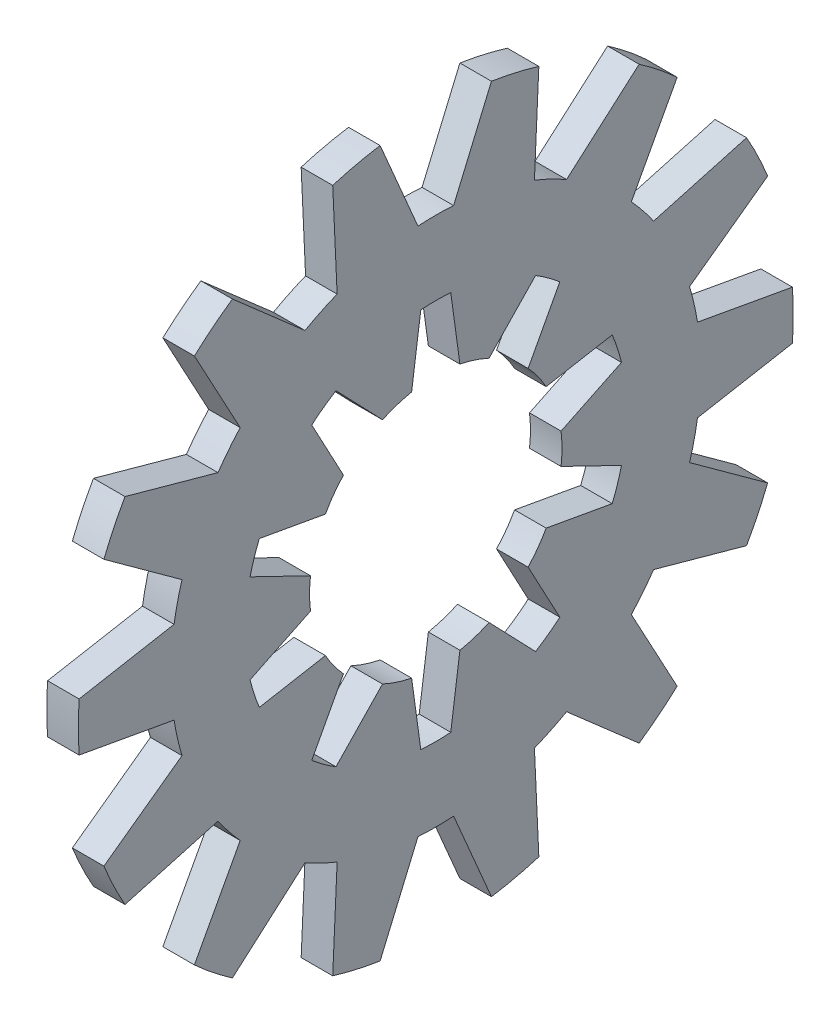
from build123d import *

# Parameters (mm, degrees)
SECSKE_W      = 0.8128
SECSKE_H      = 5.9563
EXTCUT_DEPTH  = 14.046714389
EXTCUTS_COUNT = 14
EXTCUTS_ANGLE = 334.285714286
INTCUT_DEPTH  = 13.967719177
INTCUTS_COUNT = 10
INTCUTS_ANGLE = 324


with BuildPart() as part:
    # SecSke → Body (revolve)
    with BuildSketch(Plane.XY):
        with Locations((-0.4064, 6.22935)):
            Rectangle(SECSKE_W, SECSKE_H)
    revolve(axis=Axis((-34.925, 0, 0), (1, 0, 0)))

    # ExtCutSke → ExtCut (cut, through all)
    with BuildSketch(Plane(origin=(0, 0, 0), x_dir=(0, 0, -1), z_dir=(1, 0, 0))):
        with BuildLine():
            Line((-1.619429229, 9.531277773), (-0.459109618, 6.809520567))
            ThreePointArc((-0.459109618, 6.809520567), (0, 6.82498), (0.459109618, 6.809520567))
            Line((0.459109618, 6.809520567), (1.619429229, 9.531277773))
            ThreePointArc((1.619429229, 9.531277773), (0, 9.667875), (-1.619429229, 9.531277773))
        make_face()
    extcut = extrude(amount=-EXTCUT_DEPTH, mode=Mode.SUBTRACT)

    # ExtCuts: ExtCut ×14 about axis
    extcuts_axis = Axis((-34.925, 0, 0), (1, 0, 0))
    for i in range(1, EXTCUTS_COUNT):
        add(extcut.rotate(extcuts_axis, i * EXTCUTS_ANGLE / (EXTCUTS_COUNT - 1)), mode=Mode.SUBTRACT)

    # IntCutSke → IntCut (cut, through all)
    with BuildSketch(Plane(origin=(0, 0, 0), x_dir=(0, 0, -1), z_dir=(1, 0, 0))):
        with BuildLine():
            Line((-0.385937467, 4.903800476), (-0.645327749, 3.020471676))
            ThreePointArc((-0.645327749, 3.020471676), (0, 3.08864), (0.645327749, 3.020471676))
            Line((0.645327749, 3.020471676), (0.385937467, 4.903800476))
            ThreePointArc((0.385937467, 4.903800476), (0, 4.918964), (-0.385937467, 4.903800476))
        make_face()
    intcut = extrude(amount=-INTCUT_DEPTH, mode=Mode.SUBTRACT)

    # IntCuts: IntCut ×10 about axis
    intcuts_axis = Axis((-34.925, 0, 0), (1, 0, 0))
    for i in range(1, INTCUTS_COUNT):
        add(intcut.rotate(intcuts_axis, i * INTCUTS_ANGLE / (INTCUTS_COUNT - 1)), mode=Mode.SUBTRACT)


solid = part.part
